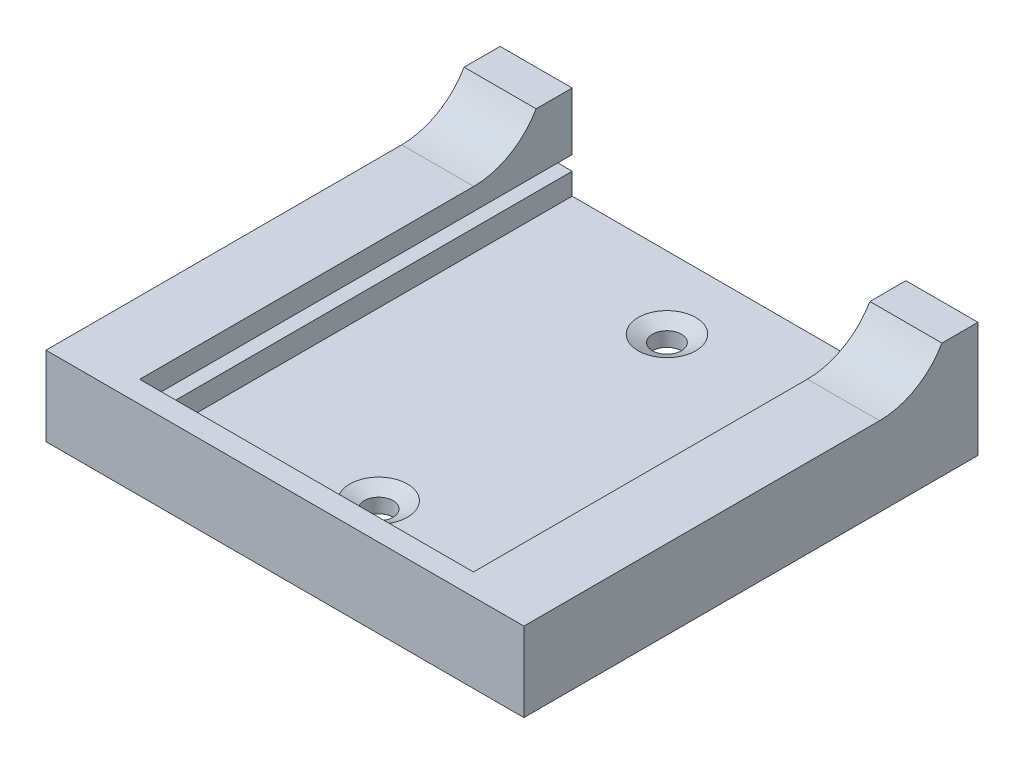
from build123d import *

# Parameters (mm, degrees)
SKETCH_1_W      = 66.3
SKETCH_1_H      = 3
BASE_DEPTH      = 60
RAILS_DEPTH     = 60
SKETCH_3_R      = 2
HOLES_DEPTH     = 90.775776243
CHAMFER_1_SIZE  = 2
CHAMFER_1_SIZE2 = 1
SKETCH_4_W      = 66.3
SKETCH_4_H      = 11
FLOOR_2_DEPTH   = 3
SKETCH_5_W      = 10
SKETCH_5_H      = 5
EXTRUDE_1_DEPTH = 5
FILLET_1_R      = 10


with BuildPart() as part:
    # Эскиз1 → base (new body)
    with BuildSketch(Plane.XY):
        with Locations((33.15, 1.5)):
            Rectangle(SKETCH_1_W, SKETCH_1_H)
    extrude(amount=BASE_DEPTH)

    # Эскиз2 → rails (add)
    with BuildSketch(Plane.XY):
        Polygon((0, 3), (10, 3), (10, 6), (3, 6), (3, 8), (10, 8), (10, 11), (0, 11), align=None)
        Polygon((56.3, 11), (56.3, 8), (63.3, 8), (63.3, 6), (56.3, 6), (56.3, 3), (66.3, 3), (66.3, 11), align=None)
    extrude(amount=RAILS_DEPTH)

    # Эскиз3 → holes (cut, through all)
    with BuildSketch(Plane(origin=(0, 3, 0), x_dir=(1, 0, 0), z_dir=(0, 1, 0))):
        with Locations(Location((33.15, -10, 0), (0, 0, 270))):
            Circle(SKETCH_3_R)
        with Locations(Location((33.15, -50, 0), (0, 0, 270))):
            Circle(SKETCH_3_R)
    extrude(amount=-HOLES_DEPTH, mode=Mode.SUBTRACT)

    # Фаска1
    chamfer_1_edges = [part.edges().sort_by_distance(p)[0] for p in [
        (33.15, 3, 8),
        (33.15, 3, 48),
    ]]
    chamfer_1_side = [part.faces().sort_by_distance(p)[0] for p in [
        (33.15, 3, 30),
    ]]
    chamfer(chamfer_1_edges, length=CHAMFER_1_SIZE, length2=CHAMFER_1_SIZE2, reference=chamfer_1_side[0])

    # Эскиз4 → floor 2 (add)
    with BuildSketch(Plane.XY.offset(60)):
        with Locations((33.15, 5.5)):
            Rectangle(SKETCH_4_W, SKETCH_4_H)
    extrude(amount=FLOOR_2_DEPTH)

    # Эскиз5 → Вытянуть1 (add)
    with BuildSketch(Plane(origin=(0, 11, 0), x_dir=(1, 0, 0), z_dir=(0, 1, 0))):
        with Locations((5, -2.5)):
            Rectangle(SKETCH_5_W, SKETCH_5_H)
        with Locations((61.3, -2.5)):
            Rectangle(SKETCH_5_W, SKETCH_5_H)
    extrude(amount=EXTRUDE_1_DEPTH)

    # Скругление1
    # the kernel refuses this fillet: 10 mm, written as the material it adds along each edge
    with BuildSketch(Plane(origin=(56.3, 11, 5), x_dir=(0, 0, 1), z_dir=(1, 0, 0))) as fillet_1_piece_1:
        with BuildLine():
            CenterArc((8.660254038, -10), FILLET_1_R, 90, 60)
            Line((0, -5), (-0.173205081, -4.9))
            ThreePointArc((-0.173205081, -4.9), (-0.2, -2.5), (-0.2, 0))
            Line((-0.2, 0), (0, 0.2))
            Line((0, 0.2), (8.660254038, 0.2))
            Line((8.660254038, 0.2), (8.660254038, 0))
        make_face()
    extrude(amount=10)
    with BuildSketch(Plane(origin=(10, 11, 5), x_dir=(0, 0, 1), z_dir=(-1, 0, 0))) as fillet_1_piece_2:
        with BuildLine():
            CenterArc((8.660254038, 10), FILLET_1_R, 210, 60)
            Line((0, 5), (-0.173205081, 4.9))
            ThreePointArc((-0.173205081, 4.9), (-0.2, 2.5), (-0.2, 0))
            Line((-0.2, 0), (0, -0.2))
            Line((0, -0.2), (8.660254038, -0.2))
            Line((8.660254038, -0.2), (8.660254038, 0))
        make_face()
    extrude(amount=10)


solid = part.part
